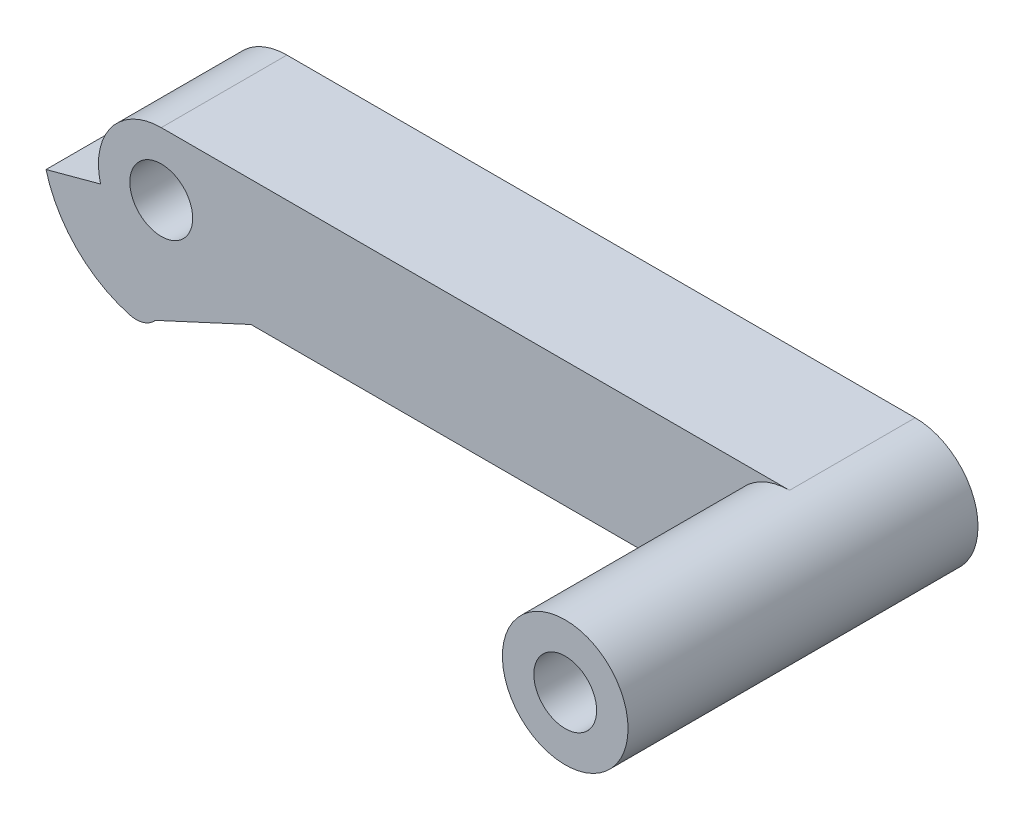
from build123d import *

# Parameters (mm, degrees)
EXTRUDE_1_DEPTH     = 10
SKETCH_2_R          = 2.500000000000002
SKETCH_2_R_2        = 2.5
CUT_EXTRUDE_1_DEPTH = 10
SKETCH_4_R          = 4.999999999999997
EXTRUDE_2_DEPTH     = 17.85
EXTRUDE_START       = -10
EXTRUDE_3_DEPTH     = 10
FILLET_1_R          = 2
CHAMFER_START       = 4
CHAMFER_1_OUTLINE_W = 8.394855713999998
CHAMFER_1_OUTLINE_H = 10
CHAMFER_1_DEPTH     = 3.536622653
SKETCH_6_R          = 2.500000000000002
CUT_EXTRUDE_2_DEPTH = 8
SKETCH_8_R          = 1.7500000000000036
CUT_EXTRUDE_4_DEPTH = 0.85
SKETCH_9_R          = 1.7499999999999967
CUT_EXTRUDE_5_DEPTH = 23.000000000000007
CUT_EXTRUDE_START   = -3
CUT_EXTRUDE_6_DEPTH = 4
FILLET_2_R          = 1
EXTRUDE_4_DEPTH     = 4
SKETCH_12_R         = 2.5
EXTRUDE_5_DEPTH     = 4


with BuildPart() as part:
    # 草图1 → 凸台-拉伸1 (new body)
    with BuildSketch(Plane.XY):
        with BuildLine():
            Line((0, 5), (50, 5.000000000000001))
            ThreePointArc((50, 5.000000000000001), (55, 0), (50, -4.999999999999997))
            Line((50, -4.999999999999997), (0, -5))
            ThreePointArc((0, -5), (-5, 6.1e-16), (0, 5))
        make_face()
    extrude(amount=EXTRUDE_1_DEPTH)

    # 草图2 → 切除-拉伸1 (cut)
    with BuildSketch(Plane.XY.offset(10)):
        with Locations((50, 0)):
            Circle(SKETCH_2_R)
        Circle(SKETCH_2_R_2)
    extrude(amount=-CUT_EXTRUDE_1_DEPTH, mode=Mode.SUBTRACT)

    # 草图4 → 凸台-拉伸2 (add)
    with BuildSketch(Plane.XY.offset(10)):
        with Locations(Location((50, 0, 0), (0, 0, 90))):
            Circle(SKETCH_4_R)
    extrude(amount=EXTRUDE_2_DEPTH)

    # 草图5 → 凸台-拉伸3 (add)
    with BuildSketch(Plane.XY.offset(10).offset(EXTRUDE_START)):
        with BuildLine():
            Line((-9.171946933133274, -2.4749524148530857), (-4.827340491122777, -1.3026065341332034))
            ThreePointArc((-4.827340491122777, -1.3026065341332034), (-3.0403097974823012, -3.9694478627805583), (5.411e-14, -5))
            Line((5.411e-14, -5), (1.028e-13, -9.5))
            ThreePointArc((1.028e-13, -9.5), (-5.7765886152163715, -7.541950939283059), (-9.171946933133274, -2.4749524148530857))
        make_face()
    extrude(amount=EXTRUDE_3_DEPTH)

    # 圆角1
    fillet_1_edges = [part.edges().sort_by_distance(p)[0] for p in [
        (1.028e-13, -9.5, 5),
    ]]
    fillet(fillet_1_edges, radius=FILLET_1_R)

    # 倒角1: read off the stored shape, not the designer's step
    # 倒角1 outline → 倒角1 (add)
    with BuildSketch(Plane(origin=(0, 0, 0), x_dir=(0.9076430982816491, 0.41974278569343915, 0), z_dir=(0.41974278569343915, -0.9076430982816494, 0)).offset(CHAMFER_START)):
        with Locations((0.18755170199999993, 5)):
            Rectangle(CHAMFER_1_OUTLINE_W, CHAMFER_1_OUTLINE_H)
    extrude(amount=CHAMFER_1_DEPTH)

    # 草图6 → 切除-拉伸2 (cut)
    with BuildSketch(Plane.XY.offset(27.85)):
        with Locations((50, 0)):
            Circle(SKETCH_6_R)
    extrude(amount=-CUT_EXTRUDE_2_DEPTH, mode=Mode.SUBTRACT)

    # 草图8 → 切除-拉伸4 (cut)
    with BuildSketch(Plane.XY.offset(19.849999999999998)):
        with Locations((50, 0)):
            Circle(SKETCH_8_R)
    extrude(amount=-CUT_EXTRUDE_4_DEPTH, mode=Mode.SUBTRACT)

    # 草图9 → 切除-拉伸5 (cut)
    with BuildSketch(Plane.XY.offset(19)):
        with Locations((50, 0)):
            Circle(SKETCH_9_R)
    extrude(amount=-CUT_EXTRUDE_5_DEPTH, mode=Mode.SUBTRACT)

    # 草图10 → 切除-拉伸6 (cut)
    with BuildSketch(Plane(origin=(0, 0, 0), x_dir=(-1, 0, 0), z_dir=(0, 0, -1)).offset(CUT_EXTRUDE_START)):
        with BuildLine():
            Line((9.171946933133274, -2.474952414853084), (4.827340491122777, -1.3026065341332034))
            ThreePointArc((4.827340491122777, -1.3026065341332034), (-4.327921927110574, 2.503815447039879), (3.535533905932719, -3.535533905932756))
            Line((3.535533905932719, -3.535533905932756), (6.717514421272165, -6.717514421272236))
            ThreePointArc((6.717514421272165, -6.717514421272236), (8.223051661510087, -4.757249349375768), (9.171946933133274, -2.474952414853084))
        make_face()
    extrude(amount=-CUT_EXTRUDE_6_DEPTH, mode=Mode.SUBTRACT)

    # 圆角2
    fillet_2_edges = [part.edges().sort_by_distance(p)[0] for p in [
        (-3.1e-16, 5, 5),
    ]]
    fillet(fillet_2_edges, radius=FILLET_2_R)

    # 草图11 → 凸台-拉伸4 (add)
    with BuildSketch(Plane.XY.offset(3)):
        with BuildLine():
            Line((-3.5355339059327213, -3.535533905932754), (-8.205808816608519, -4.78693029667969))
            ThreePointArc((-8.205808816608519, -4.78693029667969), (-7.523840965962772, -5.800156646065724), (-6.717514421272165, -6.717514421272236))
            Line((-6.717514421272165, -6.717514421272236), (-3.5355339059327213, -3.535533905932754))
        make_face()
    extrude(amount=EXTRUDE_4_DEPTH)

    # 草图12 → 凸台-拉伸5 (add)
    with BuildSketch(Plane.XY.offset(3)):
        with BuildLine():
            Line((-8.205808816608517, -4.786930296679689), (-3.5355339059327213, -3.535533905932754))
            ThreePointArc((-3.5355339059327213, -3.535533905932754), (3.435764551188546, -3.632564101126939), (3.726779962499649, 3.3333333333333344))
            ThreePointArc((3.726779962499649, 3.3333333333333344), (3.559265025824303, 4.408248290463864), (4.47213595499958, 5))
            Line((4.47213595499958, 5), (0, 5))
            ThreePointArc((0, 5), (-3.96944786278054, 3.0403097974823226), (-4.827340491122777, -1.3026065341332023))
            Line((-4.827340491122777, -1.3026065341332023), (-9.171946933133274, -2.474952414853084))
            ThreePointArc((-9.171946933133274, -2.474952414853084), (-8.765438332219034, -3.66293473106813), (-8.205808816608517, -4.786930296679689))
        make_face()
        Circle(SKETCH_12_R, mode=Mode.SUBTRACT)
    extrude(amount=EXTRUDE_5_DEPTH)


solid = part.part
